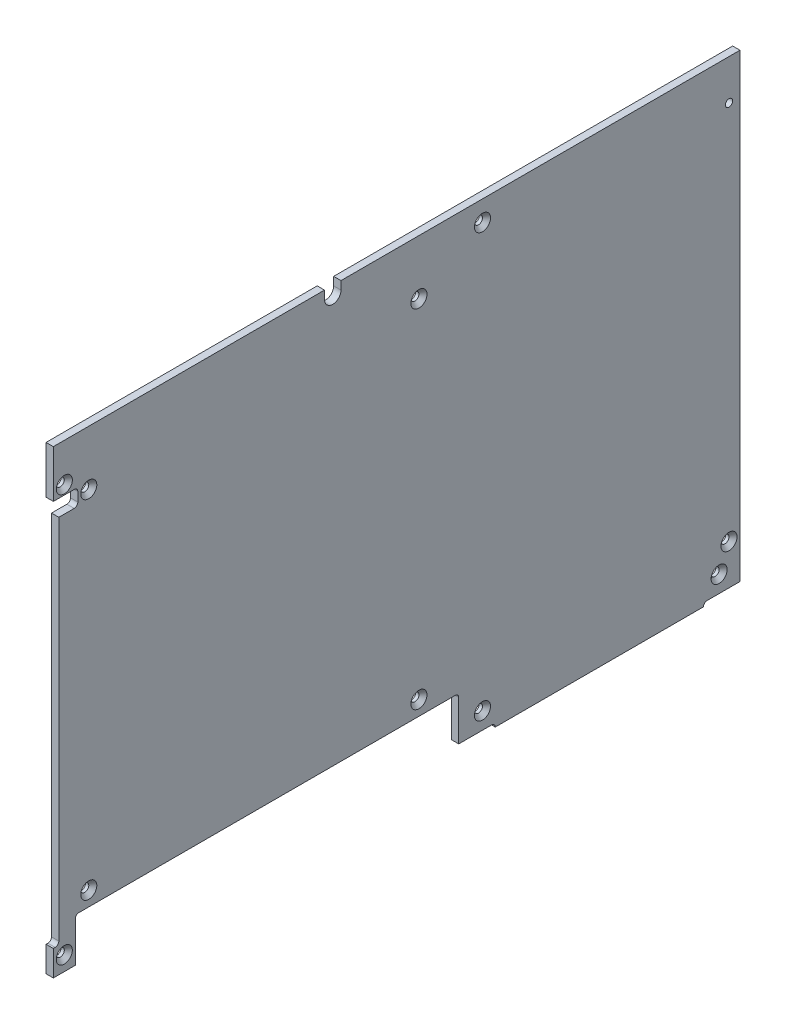
from build123d import *

# Parameters (mm, degrees)
SKETCH_1_W                = 188
SKETCH_1_H                = 150
EXTRUDE_1_DEPTH           = 2
SKETCH_13_W               = 188
SKETCH_13_H               = 12
CUT_EXTRUDE_8_DEPTH       = 11
SKETCH_5_R                = 1
EPP_DEPTH                 = 2
SKETCH_6_R                = 1
CUT_EXTRUDE_4_DEPTH       = 2
B_FAN_DEPTH               = 2
PCI_E_DEPTH               = 2
SKETCH_14_R               = 1
CUT_EXTRUDE_7447_DEPTH    = 5
IO_2_DEPTH                = 10
HOLE_WIZARD_1_AT_2_COUNT  = 2
HOLE_WIZARD_1_AT_2_PITCH  = 115.8
HOLE_WIZARD_1_AT_3_COUNT  = 2
HOLE_WIZARD_1_AT_3_PITCH  = 132.697701563
HOLE_WIZARD_1_AT_4_COUNT  = 2
HOLE_WIZARD_1_AT_4_PITCH  = 105.840068027
HOLE_WIZARD_1_AT_5_COUNT  = 2
HOLE_WIZARD_1_AT_5_PITCH  = 150.067318228
HOLE_WIZARD_1_AT_6_COUNT  = 2
HOLE_WIZARD_1_AT_6_PITCH  = 108.209056922
HOLE_WIZARD_1_AT_7_COUNT  = 2
HOLE_WIZARD_1_AT_7_PITCH  = 19.776754031
HOLE_WIZARD_1_AT_8_COUNT  = 2
HOLE_WIZARD_1_AT_8_PITCH  = 114.604799201
HOLE_WIZARD_1_AT_9_COUNT  = 2
HOLE_WIZARD_1_AT_9_PITCH  = 163.276483304
HOLE_WIZARD_1_AT_10_COUNT = 2
HOLE_WIZARD_1_AT_10_PITCH = 128.548084389
CUT_EXTRUDE_14_DEPTH      = 10
FILLET_2_R                = 1


with BuildPart() as part:
    # 草图1 → 凸台-拉伸1 (new body)
    with BuildSketch(Plane(origin=(0, 0, 0), x_dir=(0, 0, -1), z_dir=(1, 0, 0))):
        with Locations((-63.845257573, 68.271545487)):
            Rectangle(SKETCH_1_W, SKETCH_1_H)
    extrude(amount=EXTRUDE_1_DEPTH)

    # 草图13 → 切除-拉伸8 (cut)
    with BuildSketch(Plane(origin=(2, 0, 0), x_dir=(0, 0, -1), z_dir=(1, 0, 0))):
        with Locations((-63.845257573, 137.271545487)):
            Rectangle(SKETCH_13_W, SKETCH_13_H)
    extrude(amount=-CUT_EXTRUDE_8_DEPTH, mode=Mode.SUBTRACT)

    # 草图5 → EPP (cut)
    with BuildSketch(Plane.ZY):
        with Locations((40.345257573, 125.671545487)):
            Circle(SKETCH_5_R)
        with Locations((-24.454742427, 9.871545487)):
            Circle(SKETCH_5_R)
        with Locations((40.345257573, 9.871545487)):
            Circle(SKETCH_5_R)
    extrude(amount=-EPP_DEPTH, mode=Mode.SUBTRACT)

    # 草图6 → 切除-拉伸4 (cut)
    with BuildSketch(Plane.ZY):
        with Locations((57.745257573, 116.271545487)):
            Circle(SKETCH_6_R)
        with Locations((148.145257573, 116.271545487)):
            Circle(SKETCH_6_R)
        with Locations((57.745257573, 21.271545487)):
            Circle(SKETCH_6_R)
        with Locations((148.145257573, 21.271545487)):
            Circle(SKETCH_6_R)
    extrude(amount=-CUT_EXTRUDE_4_DEPTH, mode=Mode.SUBTRACT)

    # 草图3 → B-FAN (cut)
    with BuildSketch(Plane.ZY):
        Polygon((-30.154742427, -6.728454513), (46.845257573, -6.728454513), (46.845257573, 4.271545487), (46.845257573, 5.271545487), (36.845257573, 5.271545487), (36.845257573, 4.271545487), (-20.154742427, 4.271545487), (-20.154742427, 5.271545487), (-30.154742427, 5.271545487), (-30.154742427, 4.271545487), align=None)
    extrude(amount=-B_FAN_DEPTH, mode=Mode.SUBTRACT)

    # 草图10 → PCI-E (cut)
    with BuildSketch(Plane.ZY):
        Polygon((46.845257573, 5.271545487), (46.845257573, -6.728454513), (157.845257573, -6.728454513), (157.845257573, 5.271545487), (151.845257573, 5.271545487), (151.845257573, 17.271545487), (46.845257573, 17.271545487), align=None)
    extrude(amount=-PCI_E_DEPTH, mode=Mode.SUBTRACT)

    # 草图14 → Cut-Extrude 7447 (cut)
    with BuildSketch(Plane.ZY):
        with Locations((154.845257573, 120.771545487)):
            Circle(SKETCH_14_R)
        with Locations((154.845257573, 9.271545487)):
            Circle(SKETCH_14_R)
        with Locations((-27.154742427, 16.271545487)):
            Circle(SKETCH_14_R)
        with Locations((-27.154742427, 120.271545487)):
            Circle(SKETCH_14_R)
    extrude(amount=-CUT_EXTRUDE_7447_DEPTH, mode=Mode.SUBTRACT)

    # 草图15 → IO 2 (cut)
    with BuildSketch(Plane.ZY):
        Polygon((157.845257573, 118.271545487), (156.345257573, 118.271545487), (151.145257573, 118.271545487), (151.145257573, 113.771545487), (156.345257573, 113.771545487), (156.345257573, 12.271545487), (157.845257573, 12.271545487), align=None)
    extrude(amount=-IO_2_DEPTH, mode=Mode.SUBTRACT)

    # 草图17 → 打孔尺寸(%根据)内六角花形沉头螺钉的类型1 (revolve, cut)
    with BuildSketch(Plane(origin=(2, 125.671545487, 40.345257573), x_dir=(0, 0, -1), z_dir=(0, 1, 0))):
        Polygon((0, 0), (0, 2), (1.1, 2), (1.1, 1.1), (2.2, 0), align=None)
    hole_wizard_1 = revolve(axis=Axis((8.35, 125.671545487, 40.345257573), (-1, 0, 0)), mode=Mode.SUBTRACT)

    # 打孔尺寸(%根据)内六角花形沉头螺钉的类型1 at 2: 打孔尺寸(%根据)内六角花形沉头螺钉的类型1 ×2
    with Locations(*[(0, -i * HOLE_WIZARD_1_AT_2_PITCH, 0) for i in range(1, HOLE_WIZARD_1_AT_2_COUNT)]):
        add(hole_wizard_1, mode=Mode.SUBTRACT)

    # 打孔尺寸(%根据)内六角花形沉头螺钉的类型1 at 3: 打孔尺寸(%根据)内六角花形沉头螺钉的类型1 ×2
    with Locations(*[Vector(0, -0.8726601790111727, -0.4883279758197234) * (i * HOLE_WIZARD_1_AT_3_PITCH) for i in range(1, HOLE_WIZARD_1_AT_3_COUNT)]):
        add(hole_wizard_1, mode=Mode.SUBTRACT)

    # 打孔尺寸(%根据)内六角花形沉头螺钉的类型1 at 4: 打孔尺寸(%根据)内六角花形沉头螺钉的类型1 ×2
    with Locations(*[Vector(0, -0.9863939238321437, 0.16439898730535765) * (i * HOLE_WIZARD_1_AT_4_PITCH) for i in range(1, HOLE_WIZARD_1_AT_4_COUNT)]):
        add(hole_wizard_1, mode=Mode.SUBTRACT)

    # 打孔尺寸(%根据)内六角花形沉头螺钉的类型1 at 5: 打孔尺寸(%根据)内六角花形沉头螺钉的类型1 ×2
    with Locations(*[Vector(0, -0.6956877835433596, 0.7183442822411324) * (i * HOLE_WIZARD_1_AT_5_PITCH) for i in range(1, HOLE_WIZARD_1_AT_5_COUNT)]):
        add(hole_wizard_1, mode=Mode.SUBTRACT)

    # 打孔尺寸(%根据)内六角花形沉头螺钉的类型1 at 6: 打孔尺寸(%根据)内六角花形沉头螺钉的类型1 ×2
    with Locations(*[Vector(0, -0.0868688838749896, 0.9962197533748834) * (i * HOLE_WIZARD_1_AT_6_PITCH) for i in range(1, HOLE_WIZARD_1_AT_6_COUNT)]):
        add(hole_wizard_1, mode=Mode.SUBTRACT)

    # 打孔尺寸(%根据)内六角花形沉头螺钉的类型1 at 7: 打孔尺寸(%根据)内六角花形沉头螺钉的类型1 ×2
    with Locations(*[Vector(0, -0.47530550186838766, 0.8798208226074444) * (i * HOLE_WIZARD_1_AT_7_PITCH) for i in range(1, HOLE_WIZARD_1_AT_7_COUNT)]):
        add(hole_wizard_1, mode=Mode.SUBTRACT)

    # 打孔尺寸(%根据)内六角花形沉头螺钉的类型1 at 8: 打孔尺寸(%根据)内六角花形沉头螺钉的类型1 ×2
    with Locations(*[Vector(0, -0.04275562658931698, 0.9990855600973096) * (i * HOLE_WIZARD_1_AT_8_PITCH) for i in range(1, HOLE_WIZARD_1_AT_8_COUNT)]):
        add(hole_wizard_1, mode=Mode.SUBTRACT)

    # 打孔尺寸(%根据)内六角花形沉头螺钉的类型1 at 9: 打孔尺寸(%根据)内六角花形沉头螺钉的类型1 ×2
    with Locations(*[Vector(0, -0.7129011946168821, 0.7012644912683248) * (i * HOLE_WIZARD_1_AT_9_PITCH) for i in range(1, HOLE_WIZARD_1_AT_9_COUNT)]):
        add(hole_wizard_1, mode=Mode.SUBTRACT)

    # 打孔尺寸(%根据)内六角花形沉头螺钉的类型1 at 10: 打孔尺寸(%根据)内六角花形沉头螺钉的类型1 ×2
    with Locations(*[Vector(0, -0.8510434093223341, -0.5250953393899228) * (i * HOLE_WIZARD_1_AT_10_PITCH) for i in range(1, HOLE_WIZARD_1_AT_10_COUNT)]):
        add(hole_wizard_1, mode=Mode.SUBTRACT)

    # 草图23 → 切除-拉伸14 (cut)
    with BuildSketch(Plane.ZY):
        with BuildLine():
            Line((83.595257573, 133.521545487), (83.595257573, 129.021545487))
            ThreePointArc((83.595257573, 129.021545487), (81.345257573, 126.771545487), (79.095257573, 129.021545487))
            Line((79.095257573, 129.021545487), (79.095257573, 133.521545487))
            ThreePointArc((79.095257573, 133.521545487), (81.345257573, 135.771545487), (83.595257573, 133.521545487))
        make_face()
    extrude(amount=-CUT_EXTRUDE_14_DEPTH, mode=Mode.SUBTRACT)

    # 圆角2
    fillet_2_edges = [part.edges().sort_by_distance(p)[0] for p in [
        (1, 113.771545487, 151.145257573),
        (1, 118.271545487, 151.145257573),
        (1, 12.271545487, 156.345257573),
        (1, 17.271545487, 151.845257573),
        (1, 17.271545487, 46.845257573),
        (1, 5.271545487, 36.845257573),
        (1, 5.271545487, -20.154742427),
    ]]
    fillet(fillet_2_edges, radius=FILLET_2_R - 0.0001)  # a hair under: the kernel refuses the full size


solid = part.part
